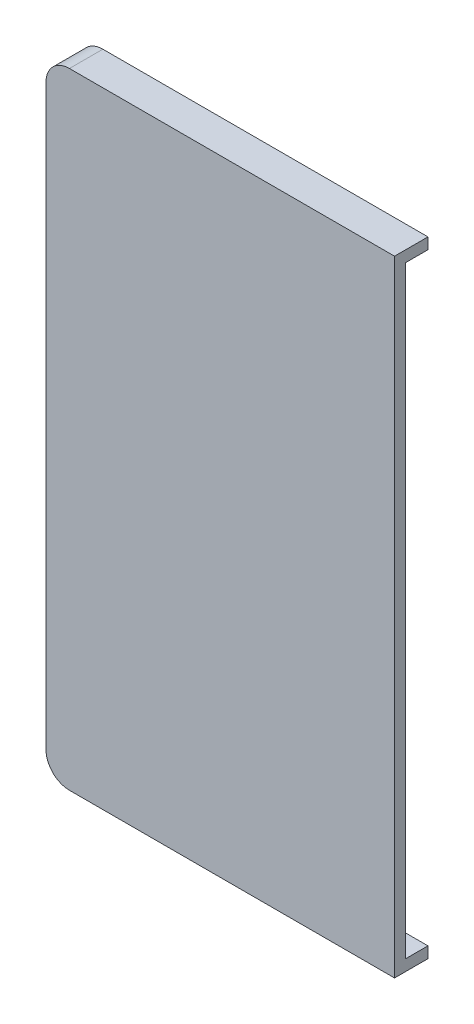
from build123d import *

# Parameters (mm, degrees)
BOSS_EXTRUDE1_DEPTH = 2
BOSS_EXTRUDE2_START = -4
BOSS_EXTRUDE2_DEPTH = 4


with BuildPart() as part:
    # Sketch1 → Boss-Extrude1 (new body)
    with BuildSketch(Plane.XY):
        with BuildLine():
            ThreePointArc((661.511242052, -1226.030951231), (658.541393571, -1227.26110275), (657.311242052, -1230.230951231))
            Line((657.311242052, -1230.230951231), (657.311242052, -1334.010951231))
            ThreePointArc((657.311242052, -1334.010951231), (658.541393571, -1336.980799712), (661.511242052, -1338.210951231))
            Line((661.511242052, -1338.210951231), (719.851242052, -1338.210951231))
            Line((719.851242052, -1338.210951231), (719.851242052, -1226.030951231))
            Line((719.851242052, -1226.030951231), (661.511242052, -1226.030951231))
        make_face()
    extrude(amount=BOSS_EXTRUDE1_DEPTH)

    # Sketch1<3> → Boss-Extrude2 (add)
    with BuildSketch(Plane.XY.offset(BOSS_EXTRUDE2_START)):
        with BuildLine():
            ThreePointArc((661.511242052, -1226.030951231), (658.541393571, -1227.26110275), (657.311242052, -1230.230951231))
            Line((657.311242052, -1230.230951231), (657.311242052, -1334.010951231))
            ThreePointArc((657.311242052, -1334.010951231), (658.541393571, -1336.980799712), (661.511242052, -1338.210951231))
            Line((661.511242052, -1338.210951231), (719.851242052, -1338.210951231))
            Line((719.851242052, -1338.210951231), (719.851242052, -1336.210951231))
            Line((719.851242052, -1336.210951231), (661.511242052, -1336.210951231))
            ThreePointArc((661.511242052, -1336.210951231), (659.955607133, -1335.56658615), (659.311242052, -1334.010951231))
            Line((659.311242052, -1334.010951231), (659.311242052, -1230.230951231))
            ThreePointArc((659.311242052, -1230.230951231), (659.955607133, -1228.675316313), (661.511242052, -1228.030951231))
            Line((661.511242052, -1228.030951231), (719.851242052, -1228.030951231))
            Line((719.851242052, -1228.030951231), (719.851242052, -1226.030951231))
            Line((719.851242052, -1226.030951231), (661.511242052, -1226.030951231))
        make_face()
    extrude(amount=BOSS_EXTRUDE2_DEPTH)


solid = part.part
